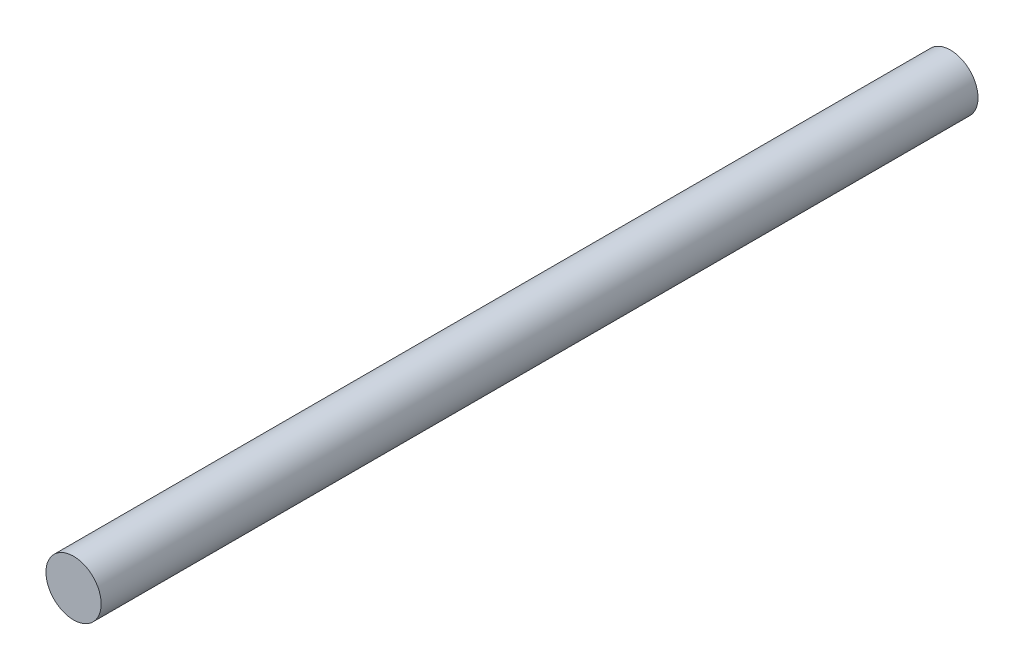
from build123d import *

# Parameters (mm, degrees)
SKETCH1_R           = 4
BOSS_EXTRUDE1_DEPTH = 63.5


with BuildPart() as part:
    # Sketch1 → Boss-Extrude1 (new, symmetric)
    with BuildSketch(Plane.XY):
        Circle(SKETCH1_R)
    extrude(amount=BOSS_EXTRUDE1_DEPTH, both=True)


solid = part.part
